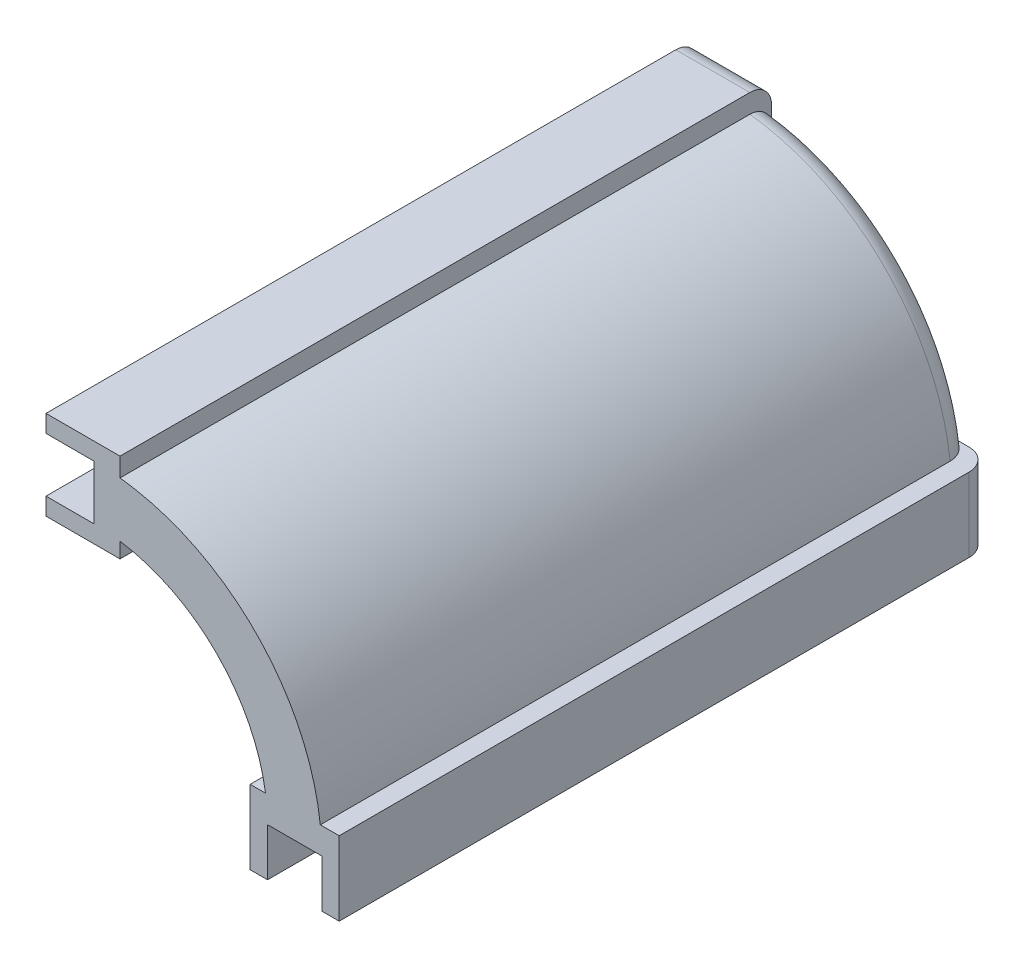
from build123d import *

# Parameters (mm, degrees)
EXTRUDE_1_DEPTH = 150
EXTRUDE_2_DEPTH = 150
FILLET_1_R      = 5
FILLET_2_R      = 5
FILLET_3_R      = 5
FILLET_4_R      = 5
FILLET_5_R      = 5


with BuildPart() as part:
    # 草图1 → 凸台-拉伸1 (new body)
    with BuildSketch(Plane.XY):
        with BuildLine():
            Line((0, 40), (0, 52.5))
            ThreePointArc((0, 52.5), (37.123106012, 37.123106012), (52.5, 0))
            Line((52.5, 0), (40, 0))
            ThreePointArc((40, 0), (28.284271247, 28.284271247), (0, 40))
        make_face()
    extrude(amount=EXTRUDE_1_DEPTH)

    # 草图2 → 凸台-拉伸2 (add)
    with BuildSketch(Plane(origin=(0, 0, 0), x_dir=(-1, 0, 0), z_dir=(0, 0, -1))):
        Polygon((11, 52.5), (11, 56.5), (-6.040960951, 56.5), (-6.040960951, 36), (11, 36), (11, 40), (0, 40), (0, 52.5), align=None)
        Polygon((-52.5, -11), (-52.5, 0), (-40, 0), (-40, -11), (-36, -11), (-36, 6.040960951), (-56.5, 6.040960951), (-56.5, -11), align=None)
    extrude(amount=-EXTRUDE_2_DEPTH)

    # 圆角1
    fillet_1_edges = [part.edges().sort_by_distance(p)[0] for p in [
        (37.123106012, 37.123106012, 0),
    ]]
    fillet(fillet_1_edges, radius=FILLET_1_R)

    # 圆角2
    # the kernel refuses this fillet: 5 mm, written as the material it takes off along each edge
    with BuildSketch(Plane(origin=(0, 0, 0), x_dir=(0.9870710552033948, -0.1602832866510314, 0), z_dir=(-0.1602832866510314, -0.9870710552033948, 0))) as fillet_2_piece_1_section:
        with BuildLine():
            CenterArc((40 + FILLET_2_R, FILLET_2_R), FILLET_2_R, 180, 90)
            Line((40, FILLET_2_R), (40, 0))
            Line((40, 0), (40 + FILLET_2_R, 0))
        make_face()
    fillet_2_piece_1 = revolve(axis=Axis((0, 0, 0), (0, 0, 1)), revolution_arc=108.446679136, mode=Mode.PRIVATE)
    fillet_2_piece_1 = split(fillet_2_piece_1, bisect_by=Plane(origin=(6.040960951, 29.285093623, 1.415376577), z_dir=(1, 0, 0)), keep=Keep.TOP, mode=Mode.PRIVATE)
    fillet_2_piece_1 = split(fillet_2_piece_1, bisect_by=Plane(origin=(29.285093623, 6.040960951, 1.415376577), z_dir=(0, 1, 0)), keep=Keep.TOP, mode=Mode.PRIVATE)
    add(fillet_2_piece_1, mode=Mode.SUBTRACT)

    # 圆角3
    fillet_3_edges = [part.edges().sort_by_distance(p)[0] for p in [
        (-2.479519525, 56.5, 0),
    ]]
    fillet(fillet_3_edges, radius=FILLET_3_R)

    # 圆角4
    fillet_4_edges = [part.edges().sort_by_distance(p)[0] for p in [
        (56.5, -2.479519525, 0),
        (-2.479519525, 36, 0),
    ]]
    fillet(fillet_4_edges, radius=FILLET_4_R)

    # 圆角5
    fillet_5_edges = [part.edges().sort_by_distance(p)[0] for p in [
        (36, -2.479519525, 0),
    ]]
    fillet(fillet_5_edges, radius=FILLET_5_R)


solid = part.part
